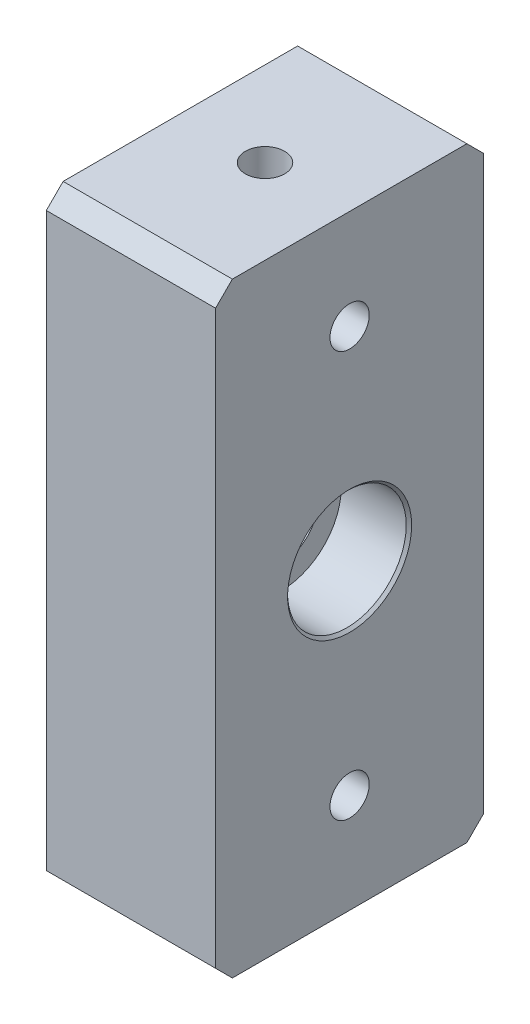
from build123d import *

# Parameters (mm, degrees)
SKETCH1_W                               = 25.146
SKETCH1_H                               = 56.769
BOSS_EXTRUDE1_DEPTH                     = 15.875
HOLE1_D                                 = 3.683
HOLE1_DEPTH                             = 12.7
HOLE1_TIP                               = 1.10648483
HOLE2_D                                 = 3.683
HOLE2_DEPTH                             = 12.7
HOLE2_TIP                               = 1.10648483
HOLE3_D                                 = 3.683
HOLE3_DEPTH                             = 23.8125
CBORE_FOR_M6_HEX_HEAD_BOLT1_D           = 6.7564
CBORE_FOR_M6_HEX_HEAD_BOLT1_CBORE_D     = 11.1252
CBORE_FOR_M6_HEX_HEAD_BOLT1_CBORE_DEPTH = 6.35
CHAMFER1_SIZE                           = 1.5748
CHAMFER2_SIZE                           = 0.254


with BuildPart() as part:
    # Sketch1 → Boss-Extrude1 (new body)
    with BuildSketch(Plane(origin=(15.875, 0, 0), x_dir=(0, 0, -1), z_dir=(1, 0, 0))):
        with Locations((-12.573, 28.7655)):
            Rectangle(SKETCH1_W, SKETCH1_H)
    extrude(amount=-BOSS_EXTRUDE1_DEPTH)

    # Hole1
    with Locations(Plane(origin=(0, 0.381, 0), x_dir=(-1, 0, 0), z_dir=(0, -1, 0))):
        with Locations((-7.9375, -12.573)):
            Hole(HOLE1_D / 2, depth=HOLE1_DEPTH)
            with Locations((0, 0, -(HOLE1_DEPTH + HOLE1_TIP / 2))):  # 118° drill point
                Cone(0, HOLE1_D / 2, HOLE1_TIP, mode=Mode.SUBTRACT)

    # Hole2
    with Locations(Plane(origin=(0, 57.15, 0), x_dir=(1, 0, 0), z_dir=(0, 1, 0))):
        with Locations((7.9375, -12.573)):
            Hole(HOLE2_D / 2, depth=HOLE2_DEPTH)
            with Locations((0, 0, -(HOLE2_DEPTH + HOLE2_TIP / 2))):  # 118° drill point
                Cone(0, HOLE2_D / 2, HOLE2_TIP, mode=Mode.SUBTRACT)

    # Hole3
    with Locations(Plane(origin=(15.875, 0, 0), x_dir=(0, 0, -1), z_dir=(1, 0, 0))):
        with Locations((-12.573, 47.8155), (-12.573, 9.7155)):
            Hole(HOLE3_D / 2, depth=HOLE3_DEPTH)

    # CBORE for M6 Hex Head Bolt1 (through all)
    with Locations(Plane(origin=(15.875, 0, 0), x_dir=(0, 0, -1), z_dir=(1, 0, 0))):
        with Locations((-12.573, 28.7655)):
            CounterBoreHole(CBORE_FOR_M6_HEX_HEAD_BOLT1_D / 2, CBORE_FOR_M6_HEX_HEAD_BOLT1_CBORE_D / 2, CBORE_FOR_M6_HEX_HEAD_BOLT1_CBORE_DEPTH)

    # Chamfer1
    chamfer1_edges = [part.edges().sort_by_distance(p)[0] for p in [
        (7.9375, 57.15, 25.146),
        (7.9375, 57.15, 0),
        (7.9375, 0.381, 0),
        (7.9375, 0.381, 25.146),
    ]]
    chamfer(chamfer1_edges, length=CHAMFER1_SIZE)

    # Chamfer2
    chamfer2_edges = [part.edges().sort_by_distance(p)[0] for p in [
        (0, 28.7655, 9.1948),
        (15.875, 28.7655, 18.1356),
    ]]
    chamfer(chamfer2_edges, length=CHAMFER2_SIZE)


solid = part.part
